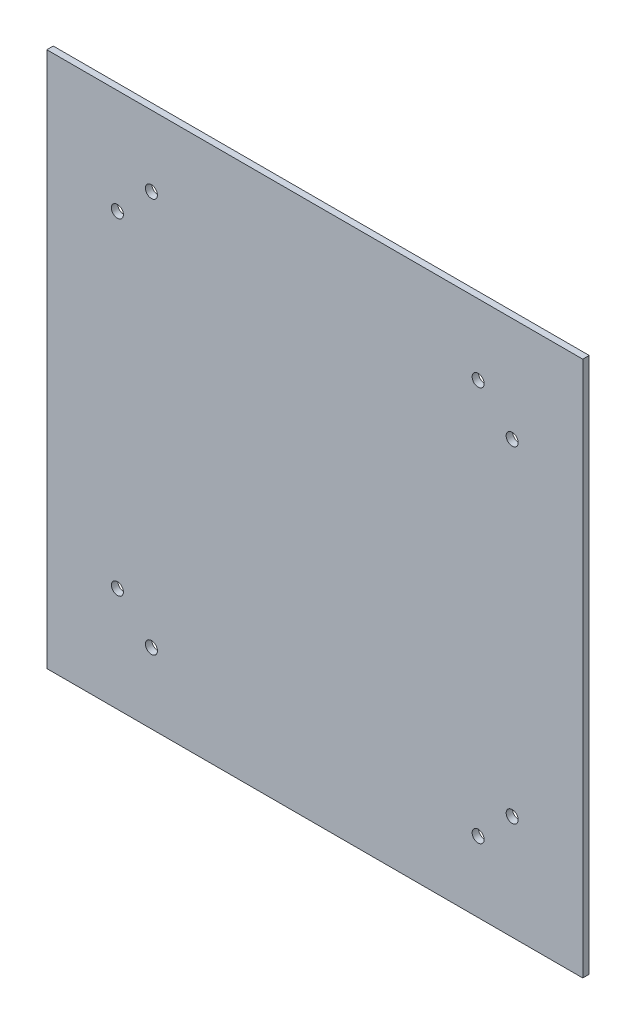
from build123d import *

# Parameters (mm, degrees)
SKETCH1_W      = 125
SKETCH1_H      = 125
SKETCH1_R      = 1.4
EXTRUDE1_DEPTH = 1.5


with BuildPart() as part:
    # Sketch1 → Extrude1 (new body)
    with BuildSketch(Plane.XY):
        Rectangle(SKETCH1_W, SKETCH1_H)
        with Locations((46.0375, 38.1)):
            Circle(SKETCH1_R, mode=Mode.SUBTRACT)
        with Locations((38.1, 46.0375)):
            Circle(SKETCH1_R, mode=Mode.SUBTRACT)
        with Locations((-38.1, 46.0375)):
            Circle(SKETCH1_R, mode=Mode.SUBTRACT)
        with Locations((-46.0375, 38.1)):
            Circle(SKETCH1_R, mode=Mode.SUBTRACT)
        with Locations((-46.0375, -38.1)):
            Circle(SKETCH1_R, mode=Mode.SUBTRACT)
        with Locations((-38.1, -46.0375)):
            Circle(SKETCH1_R, mode=Mode.SUBTRACT)
        with Locations((38.1, -46.0375)):
            Circle(SKETCH1_R, mode=Mode.SUBTRACT)
        with Locations((46.0375, -38.1)):
            Circle(SKETCH1_R, mode=Mode.SUBTRACT)
    extrude(amount=EXTRUDE1_DEPTH)


solid = part.part
